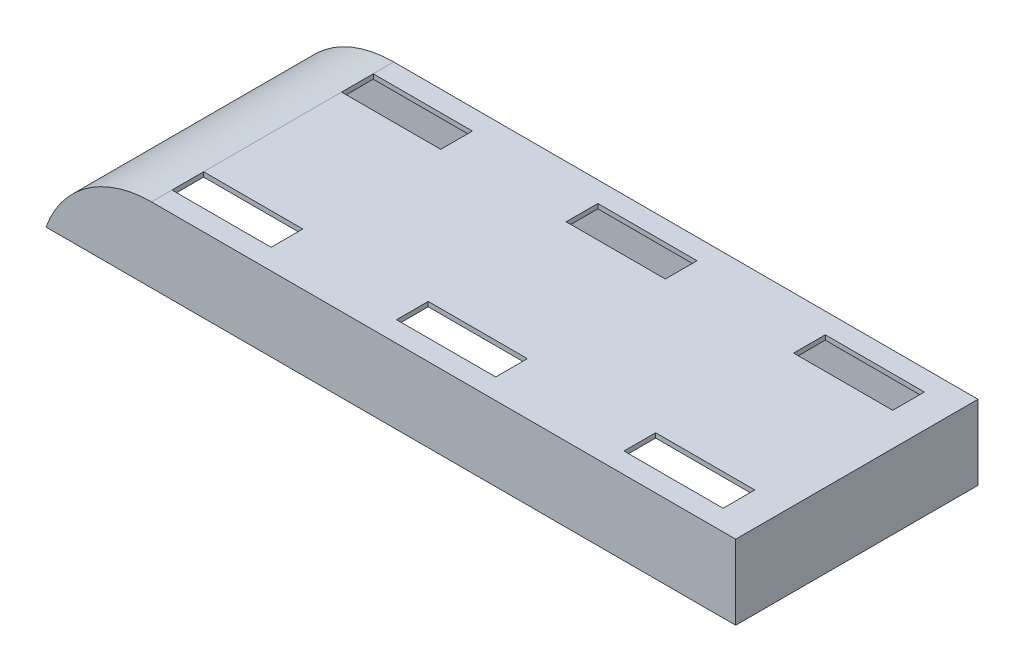
from build123d import *

# Parameters (mm, degrees)
SKETCH1_W           = 939.8
SKETCH1_H           = 330.2
BOSS_EXTRUDE1_DEPTH = 101.6
FILLET1_R           = 152.4
SHELL1_T            = -6.35
SKETCH3_W           = 135.128
SKETCH3_H           = 43.18
CUT_EXTRUDE1_DEPTH  = 127.762


with BuildPart() as part:
    # Sketch1 → Boss-Extrude1 (new body)
    with BuildSketch(Plane(origin=(0, 0, 0), x_dir=(1, 0, 0), z_dir=(0, 1, 0))):
        with Locations((469.9, 165.1)):
            Rectangle(SKETCH1_W, SKETCH1_H)
    extrude(amount=BOSS_EXTRUDE1_DEPTH)

    # Fillet1
    # the kernel refuses this fillet: 152.4 mm, written as the material it takes off along each edge
    with BuildSketch(Plane(origin=(0, 101.6, -689.410244843), x_dir=(0, -1, 0), z_dir=(0, 0, 1))) as fillet1_piece_1:
        with BuildLine():
            CenterArc((152.4, 143.684097937), FILLET1_R, 180, 70.528779366)
            Line((0, 143.684097937), (-3.048, 143.684097937))
            Line((-3.048, 143.684097937), (-3.048, 0))
            Line((-3.048, 0), (0, -3.048))
            ThreePointArc((0, -3.048), (50.8, -3.048), (100.584, -2.873681959))
            Line((100.584, -2.873681959), (101.6, 0))
        make_face()
    extrude(amount=1048.620489686, mode=Mode.SUBTRACT)

    # Shell1
    shell1_openings = [part.faces().sort_by_distance(p)[0] for p in [
        (469.9, 0, -165.1),
    ]]
    offset(amount=SHELL1_T, openings=shell1_openings, kind=Kind.INTERSECTION)

    # Sketch3 → Cut-Extrude1 (cut)
    with BuildSketch(Plane(origin=(0, 101.6, 0), x_dir=(1, 0, 0), z_dir=(0, 1, 0))):
        with Locations((517.285069024, 49.525)):
            Rectangle(SKETCH3_W, SKETCH3_H)
        with Locations((827.165069024, 280.675)):
            Rectangle(SKETCH3_W, SKETCH3_H)
        with Locations((827.165069024, 49.525)):
            Rectangle(SKETCH3_W, SKETCH3_H)
        with Locations((517.285069024, 280.675)):
            Rectangle(SKETCH3_W, SKETCH3_H)
        with Locations((211.248097937, 280.67)):
            Rectangle(SKETCH3_W, SKETCH3_H)
        with Locations((211.248097937, 49.53)):
            Rectangle(SKETCH3_W, SKETCH3_H)
    extrude(amount=-CUT_EXTRUDE1_DEPTH, mode=Mode.SUBTRACT)


solid = part.part
